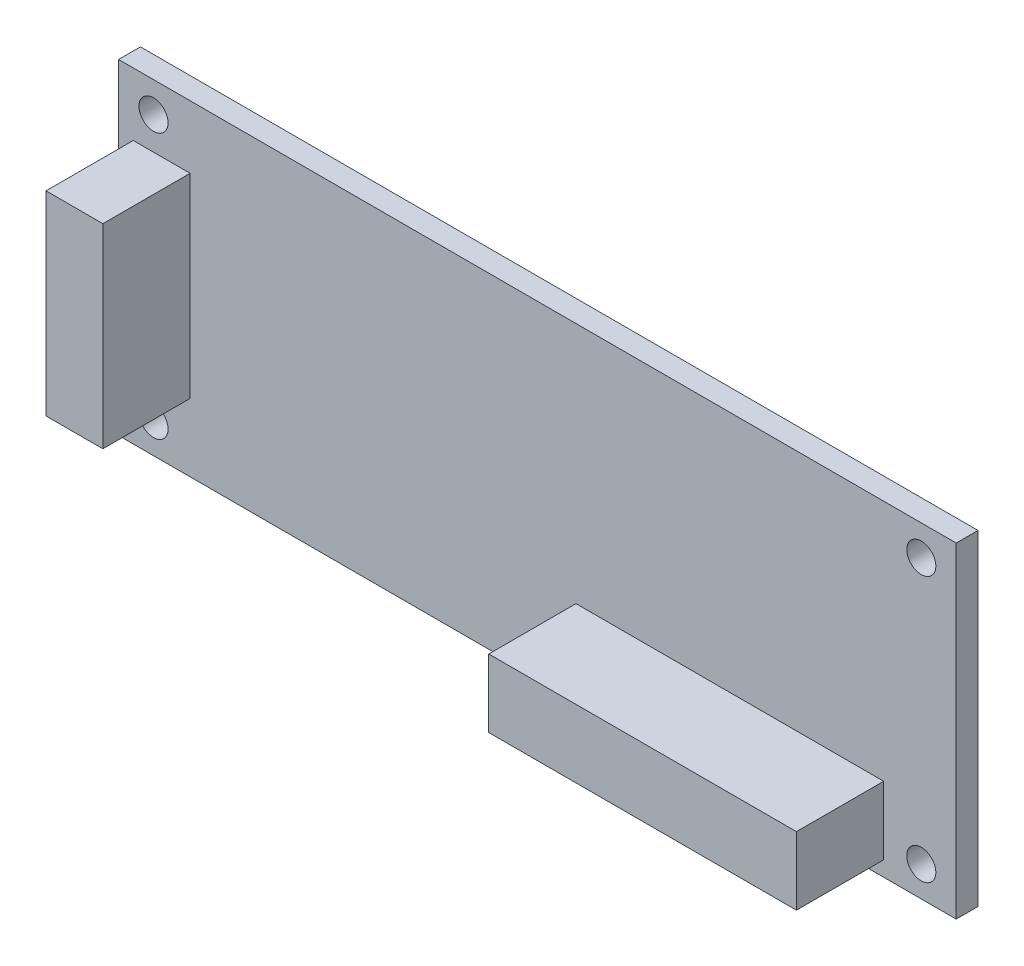
from build123d import *

# Parameters (mm, degrees)
SKETCH1_W               = 91.44
SKETCH1_H               = 35.56
BOSS_EXTRUDE1_DEPTH     = 2.38125
SKETCH2_R               = 1.5875
CUT_EXTRUDE1_DEPTH      = 50.113309312
MIRROR2_COPY_1_SKETCH_R = 1.5875
MIRROR2_COPY_1_DEPTH    = 50.113309312
MIRROR2_COPY_2_SKETCH_R = 1.5875
MIRROR2_COPY_2_DEPTH    = 50.113309312
SKETCH3_W               = 6.208251033
SKETCH3_H               = 21.285432112
SKETCH3_W_2             = 33.591072552
SKETCH3_H_2             = 7.427728914
BOSS_EXTRUDE2_DEPTH     = 9.525


with BuildPart() as part:
    # Sketch1 → Boss-Extrude1 (new body)
    with BuildSketch(Plane.XY):
        Rectangle(SKETCH1_W, SKETCH1_H)
    extrude(amount=BOSS_EXTRUDE1_DEPTH)

    # Sketch2 → Cut-Extrude1 (cut, through all)
    with BuildSketch(Plane.XY.offset(2.38125)):
        with Locations((-41.91, 14.478)):
            Circle(SKETCH2_R)
    cut_extrude1 = extrude(amount=-CUT_EXTRUDE1_DEPTH, mode=Mode.SUBTRACT)

    # Mirror1: Cut-Extrude1 across plane
    add(cut_extrude1.mirror(Plane(origin=(0, 0, 0), x_dir=(0, 0, 1), z_dir=(1, 0, 0))), mode=Mode.SUBTRACT)

    # Mirror2 copy 1 sketch → Mirror2 copy 1 (cut, through all)
    with BuildSketch(Plane(origin=(0, 0, 2.38125), x_dir=(-1, 0, 0), z_dir=(0, 0, 1))):
        with Locations((-41.91, 14.478)):
            Circle(MIRROR2_COPY_1_SKETCH_R)
    extrude(amount=-MIRROR2_COPY_1_DEPTH, mode=Mode.SUBTRACT)

    # Mirror2 copy 2 sketch → Mirror2 copy 2 (cut, through all)
    with BuildSketch(Plane.XY.offset(2.38125)):
        with Locations((-41.91, -14.478)):
            Circle(MIRROR2_COPY_2_SKETCH_R)
    extrude(amount=-MIRROR2_COPY_2_DEPTH, mode=Mode.SUBTRACT)

    # Sketch3 → Boss-Extrude2 (add)
    with BuildSketch(Plane.XY.offset(2.38125)):
        with Locations((-41.018801466, 0.277154064)):
            Rectangle(SKETCH3_W, SKETCH3_H)
        with Locations((21.008278048, -12.416502065)):
            Rectangle(SKETCH3_W_2, SKETCH3_H_2)
    extrude(amount=BOSS_EXTRUDE2_DEPTH)


solid = part.part
